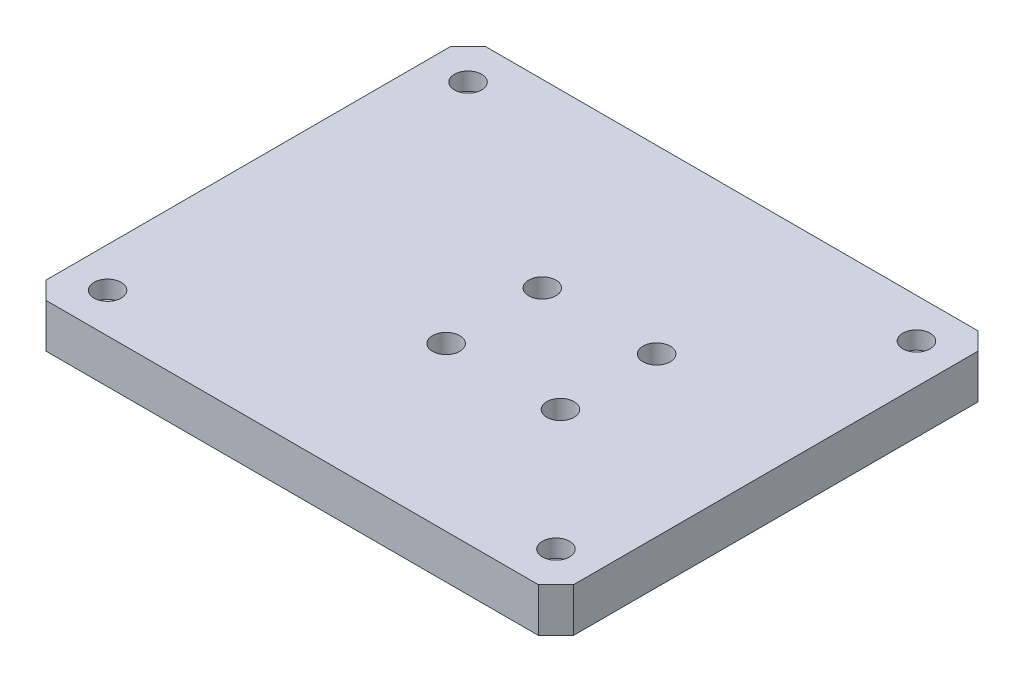
from build123d import *

# Parameters (mm, degrees)
SKETCH1_W           = 60
SKETCH1_H           = 50
BOSS_EXTRUDE1_DEPTH = 5
CHAMFER1_SIZE       = 2
SKETCH2_R           = 1.55
CUT_EXTRUDE1_DEPTH  = 2
CUT_EXTRUDE2_REACH  = 80.262
SKETCH3_R           = 1.55


with BuildPart() as part:
    # Sketch1 → Boss-Extrude1 (new body)
    with BuildSketch(Plane(origin=(0, 0, 0), x_dir=(1, 0, 0), z_dir=(0, 1, 0))):
        with Locations((30, 25)):
            Rectangle(SKETCH1_W, SKETCH1_H)
    extrude(amount=BOSS_EXTRUDE1_DEPTH)

    # Chamfer1
    chamfer1_edges = [part.edges().sort_by_distance(p)[0] for p in [
        (60, 2.5, 0),
        (60, 2.5, -50),
        (0, 2.5, 0),
        (0, 2.5, -50),
    ]]
    chamfer(chamfer1_edges, length=CHAMFER1_SIZE)

    # Sketch2 → Cut-Extrude1 (cut)
    with BuildSketch(Plane(origin=(0, 5, 0), x_dir=(1, 0, 0), z_dir=(0, 1, 0))):
        with Locations((55.5, 4.5)):
            Circle(SKETCH2_R)
        with Locations((4.5, 4.5)):
            Circle(SKETCH2_R)
        with Locations((4.5, 45.5)):
            Circle(SKETCH2_R)
        with Locations((55.5, 45.5)):
            Circle(SKETCH2_R)
    extrude(amount=-CUT_EXTRUDE1_DEPTH, mode=Mode.SUBTRACT)

    # Sketch3 → Cut-Extrude2 (cut, up to next)
    with BuildSketch(Plane(origin=(0, 5, 0), x_dir=(1, 0, 0), z_dir=(0, 1, 0)), mode=Mode.PRIVATE) as cut_extrude2_sk1:
        with Locations((42, 29.446052378)):
            Circle(SKETCH3_R)
    cut_extrude2_tool1 = extrude(cut_extrude2_sk1.sketch, amount=-CUT_EXTRUDE2_REACH, mode=Mode.PRIVATE) & part.part
    # Sketch3 → Cut-Extrude2 (cut, up to next)
    with BuildSketch(Plane(origin=(0, 5, 0), x_dir=(1, 0, 0), z_dir=(0, 1, 0)), mode=Mode.PRIVATE) as cut_extrude2_sk2:
        with Locations((29, 29.446052378)):
            Circle(SKETCH3_R)
    cut_extrude2_tool2 = extrude(cut_extrude2_sk2.sketch, amount=-CUT_EXTRUDE2_REACH, mode=Mode.PRIVATE) & part.part
    # Sketch3 → Cut-Extrude2 (cut, up to next)
    with BuildSketch(Plane(origin=(0, 5, 0), x_dir=(1, 0, 0), z_dir=(0, 1, 0)), mode=Mode.PRIVATE) as cut_extrude2_sk3:
        with Locations((42, 18.509029021)):
            Circle(SKETCH3_R)
    cut_extrude2_tool3 = extrude(cut_extrude2_sk3.sketch, amount=-CUT_EXTRUDE2_REACH, mode=Mode.PRIVATE) & part.part
    # Sketch3 → Cut-Extrude2 (cut, up to next)
    with BuildSketch(Plane(origin=(0, 5, 0), x_dir=(1, 0, 0), z_dir=(0, 1, 0)), mode=Mode.PRIVATE) as cut_extrude2_sk4:
        with Locations((29, 18.509029021)):
            Circle(SKETCH3_R)
    cut_extrude2_tool4 = extrude(cut_extrude2_sk4.sketch, amount=-CUT_EXTRUDE2_REACH, mode=Mode.PRIVATE) & part.part
    add(cut_extrude2_tool1.solids().sort_by_distance((42, 5, -29.446052))[0], mode=Mode.SUBTRACT)
    add(cut_extrude2_tool2.solids().sort_by_distance((29, 5, -29.446052))[0], mode=Mode.SUBTRACT)
    add(cut_extrude2_tool3.solids().sort_by_distance((42, 5, -18.509029))[0], mode=Mode.SUBTRACT)
    add(cut_extrude2_tool4.solids().sort_by_distance((29, 5, -18.509029))[0], mode=Mode.SUBTRACT)


solid = part.part
